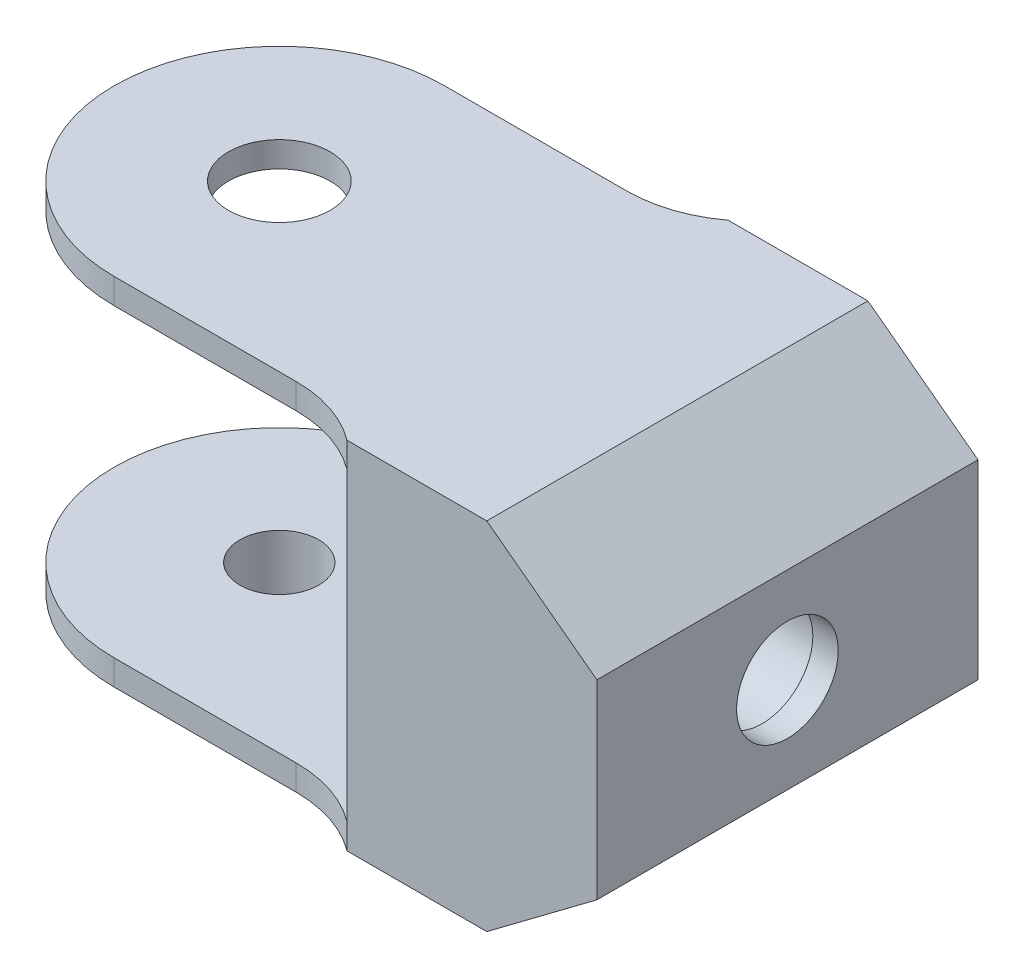
from build123d import *

# Parameters (mm, degrees)
BOSS_EXTRUDE1_DEPTH  = 2
SKETCH2_W            = 2
SKETCH2_H            = 26
BOSS_EXTRUDE2_DEPTH  = 24
BOSS_EXTRUDE3_DEPTH  = 2
SKETCH4_R            = 4
CUT_EXTRUDE1_DEPTH   = 2
BOSS_EXTRUDE4_DEPTH  = 26
CUT_EXTRUDE2_DEPTH   = 26
BOSS_EXTRUDE5_DEPTH  = 2
SKETCH8_R            = 7.515013345
SKETCH8_R_2          = 4.48835621
BOSS_EXTRUDE6_DEPTH  = 4
SKETCH9_R            = 3.1
CUT_EXTRUDE3_DEPTH   = 10
SKETCH10_R           = 4
CUT_EXTRUDE4_DEPTH   = 10
SKETCH11_R           = 4
SKETCH11_R_2         = 3.1
BOSS_EXTRUDE7_DEPTH  = 7
SKETCH12_R           = 4
BOSS_EXTRUDE8_DEPTH  = 1
SKETCH13_W           = 5
SKETCH13_H           = 10
CUT_EXTRUDE5_DEPTH   = 10
SKETCH14_W           = 5
SKETCH14_H           = 10
CUT_EXTRUDE6_DEPTH   = 4
SKETCH15_W           = 5
SKETCH15_H           = 10
BOSS_EXTRUDE9_DEPTH  = 2
SKETCH16_W           = 5
SKETCH16_H           = 2
BOSS_EXTRUDE10_DEPTH = 2
SKETCH17_W           = 5
SKETCH17_H           = 14
BOSS_EXTRUDE11_DEPTH = 2
FILLET1_R            = 10


with BuildPart() as part:
    # Sketch1 → Boss-Extrude1 (new body)
    with BuildSketch(Plane(origin=(0, 0, 0), x_dir=(1, 0, 0), z_dir=(0, 1, 0))):
        with BuildLine():
            Line((40, 13), (0, 13))
            ThreePointArc((0, 13), (-13, 0), (0, -13))
            Line((0, -13), (40, -13))
            Line((40, -13), (40, 13))
        make_face()
    extrude(amount=BOSS_EXTRUDE1_DEPTH)

    # Sketch2 → Boss-Extrude2 (add)
    with BuildSketch(Plane(origin=(0, 2, 0), x_dir=(1, 0, 0), z_dir=(0, 1, 0))):
        with Locations((39, 0)):
            Rectangle(SKETCH2_W, SKETCH2_H)
    extrude(amount=BOSS_EXTRUDE2_DEPTH)

    # Sketch3 → Boss-Extrude3 (add)
    with BuildSketch(Plane(origin=(0, 26, 0), x_dir=(1, 0, 0), z_dir=(0, 1, 0))):
        with BuildLine():
            Line((40, -13), (0, -13))
            ThreePointArc((0, -13), (-13, 0), (0, 13))
            Line((0, 13), (40, 13))
            Line((40, 13), (40, -13))
        make_face()
    extrude(amount=BOSS_EXTRUDE3_DEPTH)

    # Sketch4 → Cut-Extrude1 (cut)
    with BuildSketch(Plane(origin=(40, 0, 0), x_dir=(0, 0, -1), z_dir=(1, 0, 0))):
        with Locations((0, 14)):
            Circle(SKETCH4_R)
    extrude(amount=-CUT_EXTRUDE1_DEPTH, mode=Mode.SUBTRACT)

    # Sketch5 → Boss-Extrude4 (add)
    with BuildSketch(Plane.XY.offset(13)):
        Polygon((38, 5), (34, 2), (31.333333333, 0), (31.333333333, 2), (40, 8.5), (40, 6.5), align=None)
        Polygon((40, 21.5), (38, 23), (34, 26), (31.333333333, 28), (31.333333333, 26), (40, 19.5), align=None)
    extrude(amount=-BOSS_EXTRUDE4_DEPTH)

    # Sketch6 → Cut-Extrude2 (cut)
    with BuildSketch(Plane.XY.offset(13)):
        Polygon((38, 5), (31.333333333, 0), (40, 0), (40, 6.5), align=None)
        Polygon((40, 28), (40, 21.5), (38, 23), (31.333333333, 28), align=None)
    extrude(amount=-CUT_EXTRUDE2_DEPTH, mode=Mode.SUBTRACT)

    # Sketch7 → Boss-Extrude5 (add)
    with BuildSketch(Plane.XY.offset(13)):
        Polygon((40, 21.5), (31.333333333, 28), (20.333333333, 28), (20.333333333, 0), (31.333333333, 0), (40, 6.5), align=None)
    boss_extrude5 = extrude(amount=BOSS_EXTRUDE5_DEPTH)

    # Mirror1: Boss-Extrude5 across plane
    add(boss_extrude5.mirror(Plane.XY))

    # Sketch8 → Boss-Extrude6 (add)
    with BuildSketch(Plane.ZY.offset(-38)):
        with Locations(Location((0, 14, 0), (0, 0, 111.335065793))):
            Circle(SKETCH8_R)
        with Locations((0, 14)):
            Circle(SKETCH8_R_2, mode=Mode.SUBTRACT)
    extrude(amount=BOSS_EXTRUDE6_DEPTH)

    # Sketch9 → Cut-Extrude3 (cut)
    with BuildSketch(Plane.XZ):
        with Locations(Location((0, 0, 0), (0, 0, 270))):
            Circle(SKETCH9_R)
    extrude(amount=-CUT_EXTRUDE3_DEPTH, mode=Mode.SUBTRACT)

    # Sketch10 → Cut-Extrude4 (cut)
    with BuildSketch(Plane(origin=(0, 28, 0), x_dir=(1, 0, 0), z_dir=(0, 1, 0))):
        with Locations(Location((0, 0, 0), (0, 0, 270))):
            Circle(SKETCH10_R)
    extrude(amount=-CUT_EXTRUDE4_DEPTH, mode=Mode.SUBTRACT)

    # Sketch11 → Boss-Extrude7 (add)
    with BuildSketch(Plane.XZ):
        with Locations(Location((0, 0, 0), (0, 0, 90))):
            Circle(SKETCH11_R)
        with Locations(Location((0, 0, 0), (0, 0, 270))):
            Circle(SKETCH11_R_2, mode=Mode.SUBTRACT)
    extrude(amount=BOSS_EXTRUDE7_DEPTH)

    # Sketch12 → Boss-Extrude8 (add)
    with BuildSketch(Plane.XZ.offset(7)):
        with Locations(Location((0, 0, 0), (0, 0, 90))):
            Circle(SKETCH12_R)
    extrude(amount=BOSS_EXTRUDE8_DEPTH)

    # Sketch13 → Cut-Extrude5 (cut)
    with BuildSketch(Plane.XY.offset(15)):
        with Locations((27.833333333, 14)):
            Rectangle(SKETCH13_W, SKETCH13_H)
    extrude(amount=-CUT_EXTRUDE5_DEPTH, mode=Mode.SUBTRACT)

    # Sketch14 → Cut-Extrude6 (cut)
    with BuildSketch(Plane(origin=(0, 0, -15), x_dir=(-1, 0, 0), z_dir=(0, 0, -1))):
        with Locations((-27.833333333, 14)):
            Rectangle(SKETCH14_W, SKETCH14_H)
    extrude(amount=-CUT_EXTRUDE6_DEPTH, mode=Mode.SUBTRACT)

    # Sketch15 → Boss-Extrude9 (add)
    with BuildSketch(Plane.XY.offset(15)):
        with Locations((27.833333333, 14)):
            Rectangle(SKETCH15_W, SKETCH15_H)
    extrude(amount=-BOSS_EXTRUDE9_DEPTH)

    # Sketch16 → Boss-Extrude10 (add)
    with BuildSketch(Plane(origin=(0, 0, -15), x_dir=(-1, 0, 0), z_dir=(0, 0, -1))):
        with Locations((-27.833333333, 20)):
            Rectangle(SKETCH16_W, SKETCH16_H)
        with Locations((-27.833333333, 8)):
            Rectangle(SKETCH16_W, SKETCH16_H)
    extrude(amount=BOSS_EXTRUDE10_DEPTH)

    # Sketch17 → Boss-Extrude11 (add)
    with BuildSketch(Plane(origin=(0, 0, -17), x_dir=(-1, 0, 0), z_dir=(0, 0, -1))):
        with Locations((-27.833333333, 14)):
            Rectangle(SKETCH17_W, SKETCH17_H)
    extrude(amount=BOSS_EXTRUDE11_DEPTH)

    # Fillet1
    # the kernel refuses this fillet: 10 mm, written as the material it adds along each edge
    with BuildSketch(Plane(origin=(20.333333333, 28, 13), x_dir=(0, 0, 1), z_dir=(0, -1, 0))) as fillet1_piece_1:
        with BuildLine():
            CenterArc((10, 6), FILLET1_R, 180, 36.869897646)
            Line((0, 6), (0, 0))
            Line((0, 0), (2, 0))
        make_face()
    extrude(amount=2)
    with BuildSketch(Plane(origin=(20.333333333, 2, 13), x_dir=(-1, 0, 0), z_dir=(0, -1, 0))) as fillet1_piece_2:
        with BuildLine():
            CenterArc((6, -10), FILLET1_R, 90, 36.869897646)
            Line((0, -2), (0, 0))
            Line((0, 0), (6, 0))
        make_face()
    extrude(amount=2)
    with BuildSketch(Plane(origin=(20.333333333, 2, -13), x_dir=(-1, 0, 0), z_dir=(0, -1, 0))) as fillet1_piece_3:
        with BuildLine():
            CenterArc((6, 10), FILLET1_R, 233.130102354, 36.869897646)
            Line((0, 2), (0, 0))
            Line((0, 0), (6, 0))
        make_face()
    extrude(amount=2)
    with BuildSketch(Plane(origin=(20.333333333, 28, -13), x_dir=(0, 0, -1), z_dir=(0, -1, 0))) as fillet1_piece_4:
        with BuildLine():
            CenterArc((10, -6), FILLET1_R, 143.130102354, 36.869897646)
            Line((0, -6), (0, 0))
            Line((0, 0), (2, 0))
        make_face()
    extrude(amount=2)


solid = part.part
